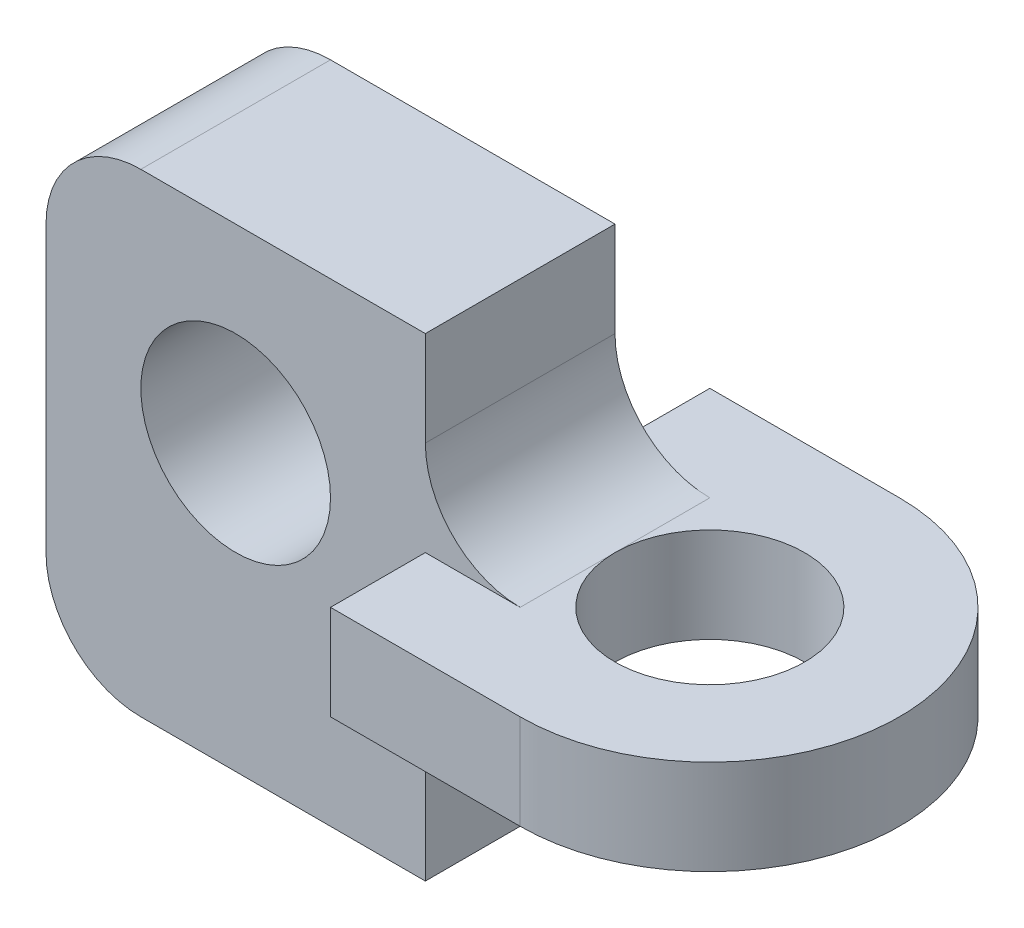
from build123d import *

# Parameters (mm, degrees)
SKETCH_1_R      = 10
EXTRUDE_1_DEPTH = 10
FILLET_1_R      = 10
SKETCH_2_R      = 10
EXTRUDE_2_DEPTH = 5


with BuildPart() as part:
    # 草圖1 → 填料-伸長1 (new, symmetric)
    with BuildSketch(Plane.XY):
        with BuildLine():
            Line((0, -5), (0, -25))
            Line((0, -25), (-30, -25))
            ThreePointArc((-30, -25), (-37.071067812, -22.071067812), (-40, -15))
            Line((-40, -15), (-40, 15))
            ThreePointArc((-40, 15), (-37.071067812, 22.071067812), (-30, 25))
            Line((-30, 25), (0, 25))
            Line((0, 25), (0, 5))
            Line((0, 5), (10, 5))
            Line((10, 5), (10, -5))
            Line((10, -5), (0, -5))
        make_face()
        with Locations((-20, 5)):
            Circle(SKETCH_1_R, mode=Mode.SUBTRACT)
    extrude(amount=EXTRUDE_1_DEPTH, both=True)

    # 圓角1
    fillet_1_edges = [part.edges().sort_by_distance(p)[0] for p in [
        (0, -5, 0),
        (0, 5, 0),
    ]]
    fillet(fillet_1_edges, radius=FILLET_1_R - 0.0001)  # a hair under: the kernel refuses the full size

    # 草圖2 → 填料-伸長2 (add, symmetric)
    with BuildSketch(Plane(origin=(0, 0, 0), x_dir=(1, 0, 0), z_dir=(0, 1, 0))):
        with BuildLine():
            Line((20, 20), (0, 20))
            Line((0, 20), (0, -20))
            Line((0, -20), (20, -20))
            ThreePointArc((20, -20), (40, 0), (20, 20))
        make_face()
        with Locations(Location((20, 0, 0), (0, 0, 180))):
            Circle(SKETCH_2_R, mode=Mode.SUBTRACT)
    extrude(amount=EXTRUDE_2_DEPTH, both=True)


solid = part.part
